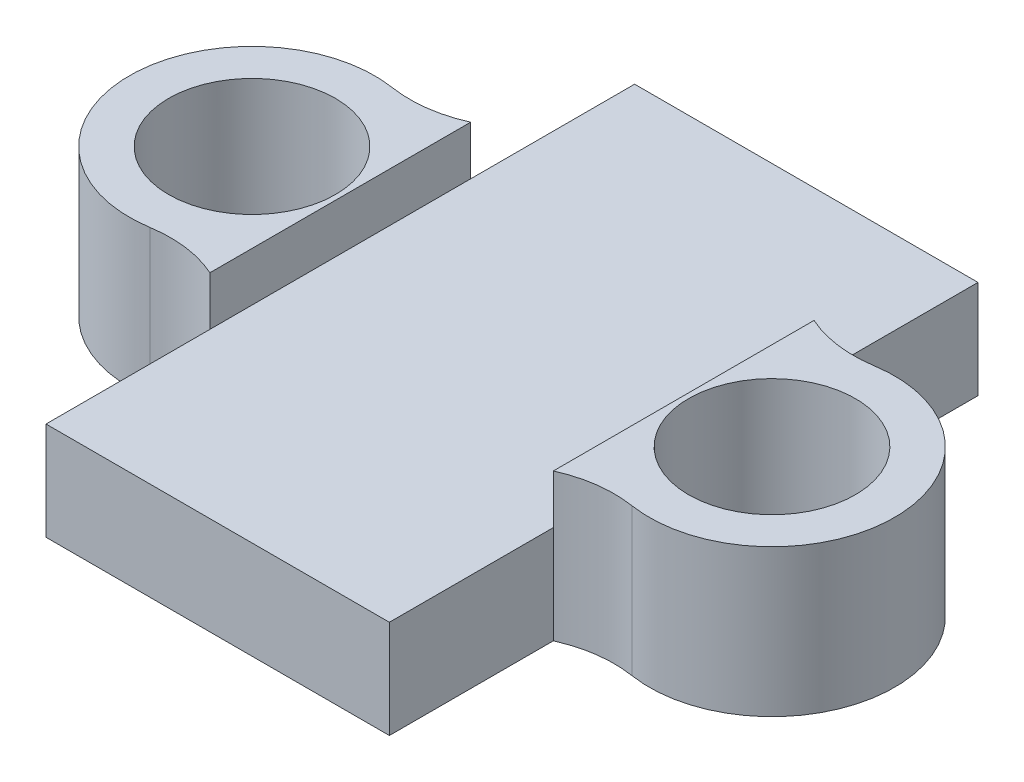
from build123d import *
from build123d.topology import SkipClean

# Parameters (mm, degrees)
CROQUIS1_R              = 1.7
SALIENTE_EXTRUIR1_DEPTH = 2
CROQUIS5_R              = 1.7
BOSS_EXTRUDE1_DEPTH     = 1


with BuildPart() as part:
    # Croquis1 → Saliente-Extruir1 (new body)
    with BuildSketch(Plane(origin=(0, 0, 0), x_dir=(1, 0, 0), z_dir=(0, 1, 0))):
        with BuildLine():
            Line((-3.5, 6), (3.5, 6))
            Line((3.5, 6), (3.5, 2.657498126))
            ThreePointArc((3.5, 2.657498126), (4.191822894, 2.460979566), (4.910964812, 2.469544821))
            ThreePointArc((4.910964812, 2.469544821), (7.8, 0), (4.910964812, -2.469544821))
            ThreePointArc((4.910964812, -2.469544821), (4.191822894, -2.460979566), (3.5, -2.657498126))
            Line((3.5, -2.657498126), (3.5, -6))
            Line((3.5, -6), (-3.5, -6))
            Line((-3.5, -6), (-3.5, -2.657498126))
            ThreePointArc((-3.5, -2.657498126), (-4.191822894, -2.460979566), (-4.910964812, -2.469544821))
            ThreePointArc((-4.910964812, -2.469544821), (-7.8, 0), (-4.910964812, 2.469544821))
            ThreePointArc((-4.910964812, 2.469544821), (-4.191822894, 2.460979566), (-3.5, 2.657498126))
            Line((-3.5, 2.657498126), (-3.5, 6))
        make_face()
        with Locations((5.3, 0)):
            Circle(CROQUIS1_R, mode=Mode.SUBTRACT)
        with Locations((-5.3, 0)):
            Circle(CROQUIS1_R, mode=Mode.SUBTRACT)
    extrude(amount=SALIENTE_EXTRUIR1_DEPTH)

    # Croquis5 → Boss-Extrude1 (add)
    # profile 1 of 2: a face of its own
    with SkipClean():  # the faces are left unmerged after this step: merging them gives an invalid solid
        with BuildSketch(Plane(origin=(0, 2, 0), x_dir=(1, 0, 0), z_dir=(0, 1, 0))):
            with BuildLine():
                ThreePointArc((4.910964812, 2.469544821), (4.191822894, 2.460979566), (3.5, 2.657498126))
                Line((3.5, 2.657498126), (3.5, -2.657498126))
                ThreePointArc((3.5, -2.657498126), (4.191822894, -2.460979566), (4.910964812, -2.469544821))
                ThreePointArc((4.910964812, -2.469544821), (7.8, 0), (4.910964812, 2.469544821))
            make_face()
            with Locations((5.3, 0)):
                Circle(CROQUIS5_R, mode=Mode.SUBTRACT)
        # profile 2 of 2: a face of its own
        with BuildSketch(Plane(origin=(0, 2, 0), x_dir=(1, 0, 0), z_dir=(0, 1, 0))):
            with BuildLine():
                ThreePointArc((-4.910964812, -2.469544821), (-4.191822894, -2.460979566), (-3.5, -2.657498126))
                Line((-3.5, -2.657498126), (-3.5, 2.657498126))
                ThreePointArc((-3.5, 2.657498126), (-4.191822894, 2.460979566), (-4.910964812, 2.469544821))
                ThreePointArc((-4.910964812, 2.469544821), (-7.8, 0), (-4.910964812, -2.469544821))
            make_face()
            with Locations((-5.3, 0)):
                Circle(CROQUIS5_R, mode=Mode.SUBTRACT)
        extrude(amount=BOSS_EXTRUDE1_DEPTH)


solid = part.part
